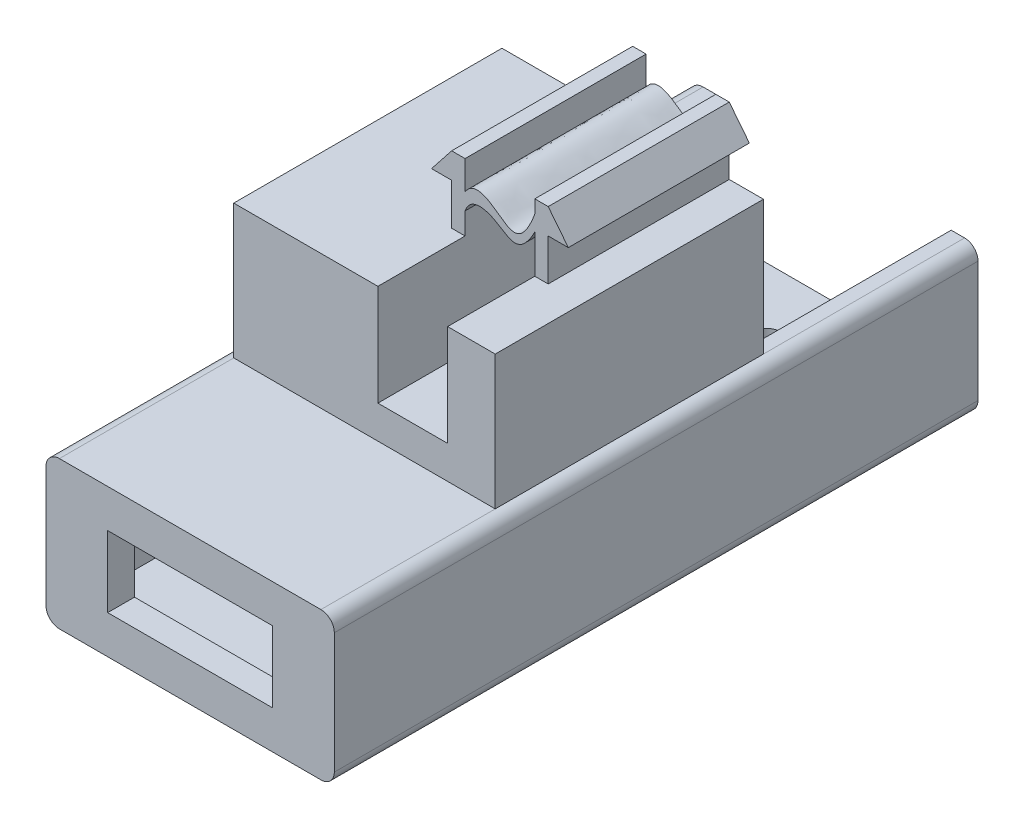
from build123d import *

# Parameters (mm, degrees)
ESBO_O1_W                = 17.5
ESBO_O1_H                = 7
RESSALTO_EXTRUS_O1_DEPTH = 36
RESSALTO_EXTRUS_O2_START = 2
ESBO_O1_3_W              = 17.5
ESBO_O1_3_H              = 7
ESBO_O1_3_W_2            = 12.3
ESBO_O1_3_H_2            = 5.3
RESSALTO_EXTRUS_O2_DEPTH = 2
RESSALTO_EXTRUS_O3_START = -36
ESBO_O1_4_W              = 17.5
ESBO_O1_4_H              = 7
RESSALTO_EXTRUS_O3_DEPTH = 10
ESBO_O2_W                = 17.5
ESBO_O2_H                = 33.092970434
CORTE_EXTRUS_O1_DEPTH    = 2
ESBO_O4_W                = 7.2
ESBO_O4_H                = 13.5
RESSALTO_EXTRUS_O4_DEPTH = 15
RESSALTO_EXTRUS_O5_START = -5
ESBO_O5_W                = 19.5
ESBO_O5_H                = 20
RESSALTO_EXTRUS_O5_DEPTH = 12
RESSALTO_EXTRUS_O6_START = -33
RESSALTO_EXTRUS_O6_DEPTH = 13.5
CORTE_EXTRUS_O2_START    = -33
CORTE_EXTRUS_O2_DEPTH    = 20
ESBO_O8_R                = 1.1
CORTE_EXTRUS_O3_DEPTH    = 12
RESSALTO_EXTRUS_O7_DEPTH = 0.3


# Read off the part's stored shape, not the designer's step: Corte-extrusão2
with BuildPart() as part:
    # Esboço1 → Ressalto-extrusão1 (new body)
    with BuildSketch(Plane.XY):
        with BuildLine():
            Line((-9.75, 5.5), (9.75, 5.5))
            ThreePointArc((9.75, 5.5), (10.457106781, 5.207106781), (10.75, 4.5))
            Line((10.75, 4.5), (10.75, -4.5))
            ThreePointArc((10.75, -4.5), (10.457106781, -5.207106781), (9.75, -5.5))
            Line((9.75, -5.5), (-9.75, -5.5))
            ThreePointArc((-9.75, -5.5), (-10.457106781, -5.207106781), (-10.75, -4.5))
            Line((-10.75, -4.5), (-10.75, 4.5))
            ThreePointArc((-10.75, 4.5), (-10.457106781, 5.207106781), (-9.75, 5.5))
        make_face()
        Rectangle(ESBO_O1_W, ESBO_O1_H, mode=Mode.SUBTRACT)
    extrude(amount=-RESSALTO_EXTRUS_O1_DEPTH)

    # Esboço1<3> → Ressalto-extrusão2 (add)
    # profile 1 of 2: a face of its own
    with BuildSketch(Plane.XY.offset(RESSALTO_EXTRUS_O2_START)):
        with BuildLine():
            Line((-9.75, 5.5), (9.75, 5.5))
            ThreePointArc((9.75, 5.5), (10.457106781, 5.207106781), (10.75, 4.5))
            Line((10.75, 4.5), (10.75, -4.5))
            ThreePointArc((10.75, -4.5), (10.457106781, -5.207106781), (9.75, -5.5))
            Line((9.75, -5.5), (-9.75, -5.5))
            ThreePointArc((-9.75, -5.5), (-10.457106781, -5.207106781), (-10.75, -4.5))
            Line((-10.75, -4.5), (-10.75, 4.5))
            ThreePointArc((-10.75, 4.5), (-10.457106781, 5.207106781), (-9.75, 5.5))
        make_face()
        Rectangle(ESBO_O1_3_W, ESBO_O1_3_H, mode=Mode.SUBTRACT)
    # profile 2 of 2: a face of its own
    with BuildSketch(Plane.XY.offset(RESSALTO_EXTRUS_O2_START)):
        Rectangle(ESBO_O1_3_W, ESBO_O1_3_H)
        Rectangle(ESBO_O1_3_W_2, ESBO_O1_3_H_2, mode=Mode.SUBTRACT)
    extrude(amount=-RESSALTO_EXTRUS_O2_DEPTH)

    # Esboço1<4> → Ressalto-extrusão3 (add)
    with BuildSketch(Plane.XY.offset(RESSALTO_EXTRUS_O3_START)):
        with BuildLine():
            Line((-9.75, 5.5), (9.75, 5.5))
            ThreePointArc((9.75, 5.5), (10.457106781, 5.207106781), (10.75, 4.5))
            Line((10.75, 4.5), (10.75, -4.5))
            ThreePointArc((10.75, -4.5), (10.457106781, -5.207106781), (9.75, -5.5))
            Line((9.75, -5.5), (-9.75, -5.5))
            ThreePointArc((-9.75, -5.5), (-10.457106781, -5.207106781), (-10.75, -4.5))
            Line((-10.75, -4.5), (-10.75, 4.5))
            ThreePointArc((-10.75, 4.5), (-10.457106781, 5.207106781), (-9.75, 5.5))
        make_face()
        Rectangle(ESBO_O1_4_W, ESBO_O1_4_H, mode=Mode.SUBTRACT)
    extrude(amount=-RESSALTO_EXTRUS_O3_DEPTH)

    # Esboço2 → Corte-extrusão1 (cut)
    with BuildSketch(Plane(origin=(0, 5.5, 0), x_dir=(1, 0, 0), z_dir=(0, 1, 0))):
        with Locations((0, 47.546485217)):
            Rectangle(ESBO_O2_W, ESBO_O2_H)
    extrude(amount=-CORTE_EXTRUS_O1_DEPTH, mode=Mode.SUBTRACT)

    # Esboço4 → Ressalto-extrusão4 (add)
    with BuildSketch(Plane(origin=(0, 5.5, 0), x_dir=(1, 0, 0), z_dir=(0, 1, 0))):
        with Locations((3.6, 24.25)):
            Rectangle(ESBO_O4_W, ESBO_O4_H)
    extrude(amount=RESSALTO_EXTRUS_O4_DEPTH)

    # Esboço5 → Ressalto-extrusão5 (add)
    with BuildSketch(Plane(origin=(0, 20.5, 0), x_dir=(1, 0, 0), z_dir=(0, 1, 0)).offset(RESSALTO_EXTRUS_O5_START)):
        with Locations((0, 21)):
            Rectangle(ESBO_O5_W, ESBO_O5_H)
    extrude(amount=-RESSALTO_EXTRUS_O5_DEPTH)

    # Esboço6 → Ressalto-extrusão6 (add)
    with BuildSketch(Plane.XY.offset(2).offset(RESSALTO_EXTRUS_O6_START)):
        Polygon((7.2, 18.6), (8.7, 18.6), (7.2, 20.5), align=None)
        Polygon((0, 20.5), (-1.5, 18.6), (0, 18.6), align=None)
    extrude(amount=RESSALTO_EXTRUS_O6_DEPTH)

    # Corte-extrusão2 outline → Corte-extrusão2 (cut)
    with BuildSketch(Plane.XY.offset(2).offset(CORTE_EXTRUS_O2_START)):
        with BuildLine():
            add(Edge.make_bspline(
                [(1, 17.117776301), (1.392807157, 18.242284914), (3.793782864, 17.798079271), (4.98009006, 16.063611632), (6.2, 18.349246613)],
                knots=[0, 0, 0, 0, 0.431650305, 1, 1, 1, 1], degree=3))
            Line((1, 17.117776301), (1, 7.955613614))
            Line((1, 7.955613614), (6.2, 7.955613614))
            Line((6.2, 7.955613614), (6.2, 18.349246613))
        make_face()
        with BuildLine():
            Line((1, 20.5), (1, 18.349246613))
            add(Edge.make_bspline(
                [(1, 18.349246613), (1.607043976, 19.318450945), (3.826530144, 18.190561083), (5.118160412, 16.666681538), (6.2, 19.514216644)],
                knots=[0, 0, 0, 0, 0.401373469, 1, 1, 1, 1], degree=3))
            Line((6.2, 19.514216644), (6.2, 20.5))
            Line((6.2, 20.5), (1, 20.5))
        make_face()
    extrude(amount=CORTE_EXTRUS_O2_DEPTH, mode=Mode.SUBTRACT)

    # Esboço8 → Corte-extrusão3 (cut)
    with BuildSketch(Plane(origin=(0, -3.5, 0), x_dir=(1, 0, 0), z_dir=(0, 1, 0))):
        with Locations(Location((0, 41, 0), (0, 0, 270))):
            Circle(ESBO_O8_R)
    extrude(amount=-CORTE_EXTRUS_O3_DEPTH, mode=Mode.SUBTRACT)

    # Esboço10 → Ressalto-extrusão7 (add)
    # profile 1 of 2: a face of its own
    with BuildSketch(Plane.XZ.offset(5.5)):
        with BuildLine():
            add(Edge.make_bspline(
                [(-0.318359524, -4.649786515), (-0.12793019, -4.650877011), (0.246048441, -4.653018606), (0.794689133, -4.690127467), (1.320581721, -4.739039837), (1.821657676, -4.818693553), (2.300262204, -4.912395404), (2.756253242, -5.02959155), (3.18803164, -5.170771406), (3.46371748, -5.283081098), (3.598943855, -5.338170009)],
                knots=[0, 0, 0, 0, 1.141009212, 2.240794809, 3.294380675, 4.305229195, 5.280013876, 6.216333343, 7.125095522, 8, 8, 8, 8], degree=3))
            add(Edge.make_bspline(
                [(3.598943855, -5.338170009), (3.79118381, -5.428219471), (4.173402664, -5.607259266), (4.713508633, -5.939764305), (5.222872323, -6.316639162), (5.698823441, -6.73478113), (6.134196809, -7.183514911), (6.506813723, -7.664957424), (6.82925825, -8.162004461), (6.991428682, -8.515517746), (7.071730538, -8.690566754)],
                knots=[0, 0, 0, 0, 1.031372299, 2.050613973, 3.077158538, 4.108712802, 5.127684358, 6.111366908, 7.06480644, 8, 8, 8, 8], degree=3))
            add(Edge.make_bspline(
                [(7.071730538, -8.690566754), (7.120468921, -8.809389364), (7.218981622, -9.049560157), (7.341930633, -9.422813839), (7.441821148, -9.810229821), (7.53111163, -10.209005948), (7.592680355, -10.623014004), (7.644303615, -11.04890863), (7.671360263, -11.489020603), (7.674945253, -11.786717922), (7.676767151, -11.938008168)],
                knots=[0, 0, 0, 0, 0.92659354, 1.872881803, 2.832850937, 3.813025581, 4.820167273, 5.851730198, 6.908245912, 8, 8, 8, 8], degree=3))
            add(Edge.make_bspline(
                [(7.676767151, -11.938008168), (7.669976662, -12.208905077), (7.656687581, -12.739054053), (7.560701949, -13.513452664), (7.398621846, -14.246269512), (7.164354407, -14.935021059), (6.871520627, -15.585656135), (6.508273094, -16.193080816), (6.078635852, -16.758339223), (5.588150779, -17.279791373), (5.039438057, -17.750630074), (4.4318831, -18.155010942), (3.778557115, -18.503556481), (3.071006482, -18.78464113), (2.313225925, -19.003878553), (1.503521424, -19.154267563), (0.645195065, -19.254187743), (0.05545634, -19.264269818), (-0.24736033, -19.269446721)],
                knots=[0, 0, 0, 0, 1.064687426, 2.083607927, 3.061933343, 4.009715682, 4.938290439, 5.861555806, 6.785379163, 7.723907601, 8.670645075, 9.620815051, 10.587025556, 11.576201955, 12.607926824, 13.682791464, 14.810169074, 16, 16, 16, 16], degree=3))
            add(Edge.make_bspline(
                [(-0.24736033, -19.269446721), (-0.548086723, -19.263918039), (-1.133544825, -19.253154726), (-1.986081316, -19.158160766), (-2.788767815, -19.007696263), (-3.539777018, -18.785181607), (-4.24481722, -18.510870632), (-4.895570638, -18.164074501), (-5.500378713, -17.763216269), (-6.045659537, -17.294120416), (-6.536753605, -16.778134971), (-6.961493857, -16.214126635), (-7.326827182, -15.613061753), (-7.62029786, -14.965663697), (-7.848642587, -14.277378868), (-8.012276099, -13.548546803), (-8.108284401, -12.778159291), (-8.121502915, -12.251089443), (-8.12827091, -11.981225069)],
                knots=[0, 0, 0, 0, 1.188503542, 2.313794348, 3.386815875, 4.412724616, 5.406050757, 6.372287373, 7.322246111, 8.268662201, 9.209598637, 10.133005659, 11.054574072, 11.984756797, 12.936664457, 13.916615443, 14.933288873, 16, 16, 16, 16], degree=3))
            add(Edge.make_bspline(
                [(-8.12827091, -11.981225069), (-8.121426486, -11.708286804), (-8.108029982, -11.174068208), (-8.012887708, -10.394325518), (-7.848642713, -9.657371462), (-7.62056875, -8.964275132), (-7.328947854, -8.312250075), (-6.970008484, -7.705067339), (-6.542488593, -7.1423328), (-6.055256333, -6.62501445), (-5.512789328, -6.156062573), (-4.911695972, -5.755944821), (-4.267346355, -5.409083549), (-3.569985219, -5.133343557), (-2.82678612, -4.91205054), (-2.033473022, -4.76121942), (-1.192229223, -4.666041476), (-0.614973631, -4.655303872), (-0.318359524, -4.649786515)],
                knots=[0, 0, 0, 0, 1.080868081, 2.11556935, 3.105256676, 4.066632898, 5.000538419, 5.928691231, 6.853779256, 7.79363201, 8.738674366, 9.686979733, 10.647777075, 11.631556772, 12.651514868, 13.714488213, 14.825624133, 16, 16, 16, 16], degree=3))
        make_face()
        with BuildLine():
            add(Edge.make_bspline(
                [(-0.216491115, -7.613231151), (-0.429651959, -7.616189427), (-0.84243388, -7.621918071), (-1.441559658, -7.683009893), (-2.001721274, -7.775574148), (-2.521998116, -7.91220869), (-3.004172685, -8.083299354), (-3.444749643, -8.29878683), (-3.849739358, -8.54672345), (-4.206842824, -8.840221686), (-4.526052531, -9.157222984), (-4.800868823, -9.499369911), (-5.040397809, -9.858237991), (-5.226890094, -10.244153971), (-5.375920836, -10.647299276), (-5.486234351, -11.070749559), (-5.546848882, -11.516415341), (-5.555537592, -11.820532712), (-5.559952225, -11.975051226)],
                knots=[0, 0, 0, 0, 1.313760844, 2.544072881, 3.709057706, 4.810798106, 5.856328071, 6.8578978, 7.829608234, 8.776800457, 9.700893773, 10.598542645, 11.478326183, 12.355016441, 13.234159304, 14.125057487, 15.047363429, 16, 16, 16, 16], degree=3))
            add(Edge.make_bspline(
                [(-5.559952225, -11.975051226), (-5.555626084, -12.129589921), (-5.547111541, -12.433747015), (-5.485271824, -12.878874221), (-5.379638311, -13.303130813), (-5.231554886, -13.704794071), (-5.041020964, -14.085695441), (-4.808782167, -14.445500461), (-4.531518099, -14.782145399), (-4.217149655, -15.0989679), (-3.857515474, -15.384327145), (-3.453408382, -15.630665859), (-3.009263386, -15.842858972), (-2.52124366, -16.009007859), (-1.994937004, -16.148311591), (-1.423667945, -16.235374928), (-0.812608421, -16.297469204), (-0.39056349, -16.303102031), (-0.173274214, -16.306002085)],
                knots=[0, 0, 0, 0, 0.949185128, 1.868149516, 2.754265681, 3.630223372, 4.492411659, 5.365559627, 6.255051142, 7.166857153, 8.10270998, 9.067572068, 10.068471475, 11.120005306, 12.229988237, 13.408413857, 14.665725295, 16, 16, 16, 16], degree=3))
            add(Edge.make_bspline(
                [(-0.173274214, -16.306002085), (0.041905138, -16.302679594), (0.458620399, -16.296245274), (1.062127351, -16.240278251), (1.623535554, -16.14845759), (2.14298021, -16.021328537), (2.619176631, -15.851741064), (3.057185756, -15.655054088), (3.449681878, -15.410887428), (3.799600354, -15.131914923), (4.109155361, -14.82315549), (4.375439671, -14.487368695), (4.604113279, -14.129364681), (4.789097268, -13.745886032), (4.932302825, -13.336697367), (5.032546934, -12.903991575), (5.096184495, -12.447165477), (5.104299837, -12.134757009), (5.108448466, -11.975051226)],
                knots=[0, 0, 0, 0, 1.332102096, 2.579742291, 3.748638211, 4.851919079, 5.885623862, 6.874802917, 7.818925756, 8.739297243, 9.640302518, 10.519879355, 11.387702267, 12.265338757, 13.149908458, 14.066302139, 15.011477716, 16, 16, 16, 16], degree=3))
            add(Edge.make_bspline(
                [(5.108448466, -11.975051226), (5.10430966, -11.815342659), (5.096213535, -11.502928747), (5.032438084, -11.046141715), (4.932396642, -10.612013293), (4.786600773, -10.201724245), (4.597046927, -9.816993236), (4.366242493, -9.456496244), (4.096797722, -9.11763946), (3.784071459, -8.806048036), (3.430953411, -8.522463499), (3.03283588, -8.279015324), (2.594045202, -8.071424218), (2.113288617, -7.90110721), (1.589241849, -7.774849786), (1.025427317, -7.677810403), (0.418432336, -7.623316694), (-0.000301229, -7.616665254), (-0.216491115, -7.613231151)],
                knots=[0, 0, 0, 0, 0.981979984, 1.920900141, 2.831228887, 3.718021039, 4.592624278, 5.463440991, 6.346090553, 7.250083161, 8.173257457, 9.125226447, 10.113224917, 11.154132427, 12.2562525, 13.424702564, 14.670387795, 16, 16, 16, 16], degree=3))
        make_face(mode=Mode.SUBTRACT)
    # profile 2 of 2: a face of its own
    with BuildSketch(Plane.XZ.offset(5.5)):
        with BuildLine():
            Line((-4.967263298, -31.123225267), (-7.930707934, -31.123225267))
            Line((-7.930707934, -31.123225267), (-7.930707934, -21.047513503))
            add(Edge.make_bspline(
                [(-7.930707934, -21.047513503), (-7.677461185, -21.08169368), (-7.171109687, -21.150034869), (-6.430688049, -21.36002255), (-5.709822746, -21.645486972), (-5.123768375, -21.952229314), (-4.647213352, -22.250502688), (-4.264038121, -22.531143682), (-3.848227601, -22.855209585), (-3.409500986, -23.233532662), (-2.939338814, -23.656674254), (-2.44188602, -24.129897218), (-1.918943103, -24.654694026), (-1.563864395, -25.02393212), (-1.380260519, -25.214857523)],
                knots=[0, 0, 0, 0, 1.156381417, 2.312114436, 3.475445649, 4.663832578, 5.302694182, 6.020660876, 6.814180865, 7.69035705, 8.644181007, 9.679458435, 10.800095821, 12, 12, 12, 12], degree=3))
            add(Edge.make_bspline(
                [(-1.380260519, -25.214857523), (-1.233220685, -25.36724459), (-0.953300147, -25.657344683), (-0.552036681, -26.070000785), (-0.185140792, -26.43378533), (0.145055063, -26.75080218), (0.434830178, -27.025270939), (0.690893828, -27.249813118), (0.908449981, -27.431431084), (1.046568733, -27.529701329), (1.107798207, -27.573265546)],
                knots=[0, 0, 0, 0, 1.480739016, 2.818890974, 4.024686436, 5.093297083, 6.019761393, 6.815071481, 7.474708909, 8, 8, 8, 8], degree=3))
            add(Edge.make_bspline(
                [(1.107798207, -27.573265546), (1.2558394, -27.662934162), (1.541057086, -27.835690639), (1.992674051, -28.018437884), (2.440321138, -28.137711643), (2.741101168, -28.152507576), (2.88895191, -28.159780631)],
                knots=[0, 0, 0, 0, 1.091434863, 2.102769638, 3.067401785, 4, 4, 4, 4], degree=3))
            add(Edge.make_bspline(
                [(2.88895191, -28.159780631), (3.042748941, -28.154333828), (3.333720928, -28.144028903), (3.743211787, -28.054759227), (4.097726741, -27.903309635), (4.393081198, -27.687367285), (4.626504492, -27.415397793), (4.7962506, -27.09553377), (4.892047149, -26.726653966), (4.904419293, -26.467675859), (4.910885491, -26.332323105)],
                knots=[0, 0, 0, 0, 1.192552326, 2.256215989, 3.232470907, 4.163657734, 5.069678789, 5.991331675, 6.950186205, 8, 8, 8, 8], degree=3))
            add(Edge.make_bspline(
                [(4.910885491, -26.332323105), (4.904795932, -26.197914197), (4.893032219, -25.938265206), (4.790266039, -25.569247653), (4.612366969, -25.246425401), (4.409633819, -25.016365095), (4.212490555, -24.860948446), (4.040693187, -24.755052963), (3.845478692, -24.663779324), (3.629044861, -24.582903264), (3.388912215, -24.519020321), (3.126909606, -24.467572965), (2.841627088, -24.42611384), (2.643164206, -24.412929106), (2.540129781, -24.406084091)],
                knots=[0, 0, 0, 0, 1.402788338, 2.709884207, 3.961032948, 5.225417836, 5.883680772, 6.578928686, 7.329201998, 8.132101139, 8.990263233, 9.922304639, 10.921339128, 12, 12, 12, 12], degree=3))
            Line((2.540129781, -24.406084091), (2.830300402, -21.442639455))
            add(Edge.make_bspline(
                [(2.830300402, -21.442639455), (3.030370267, -21.466465091), (3.418273769, -21.512659192), (3.975436945, -21.627937346), (4.489445125, -21.773932856), (4.959344403, -21.957605821), (5.388122882, -22.171364814), (5.769346474, -22.426113321), (6.107238057, -22.712950162), (6.4016178, -23.032123226), (6.6534222, -23.381603428), (6.878196267, -23.748320191), (7.062582454, -24.139440186), (7.214544376, -24.55065717), (7.335991129, -24.981785306), (7.416290075, -25.434818619), (7.472772662, -25.906961158), (7.477028027, -26.229247626), (7.479204175, -26.394061535)],
                knots=[0, 0, 0, 0, 1.270971563, 2.464210789, 3.586263665, 4.638946707, 5.643716971, 6.603612468, 7.52484387, 8.434700188, 9.336036235, 10.239171475, 11.145359471, 12.059630629, 13.003312604, 13.96741569, 14.960557767, 16, 16, 16, 16], degree=3))
            add(Edge.make_bspline(
                [(7.479204175, -26.394061535), (7.475760876, -26.57323578), (7.469054617, -26.92220012), (7.413664359, -27.431622215), (7.317107705, -27.910202164), (7.189125985, -28.362057564), (7.018541203, -28.782783024), (6.810934505, -29.17579161), (6.563014033, -29.537089837), (6.281670155, -29.867067219), (5.975487731, -30.163233983), (5.643731167, -30.416793045), (5.299398817, -30.639401565), (4.9308979, -30.814148796), (4.547472015, -30.956520761), (4.142355955, -31.048128307), (3.721550366, -31.115116124), (3.433561344, -31.120492325), (3.287164784, -31.123225267)],
                knots=[0, 0, 0, 0, 1.21054264, 2.357683783, 3.456743179, 4.506371233, 5.526380269, 6.518616322, 7.504105716, 8.480749833, 9.444588379, 10.376395364, 11.298423092, 12.209585683, 13.126776925, 14.056012185, 15.011791738, 16, 16, 16, 16], degree=3))
            add(Edge.make_bspline(
                [(3.287164784, -31.123225267), (3.119192924, -31.119448107), (2.785962531, -31.111954801), (2.293291226, -31.040445967), (1.812206624, -30.930655774), (1.340056045, -30.77027373), (0.870619413, -30.559585259), (0.392323704, -30.301661293), (-0.09442336, -29.989255143), (-0.413418499, -29.751545746), (-0.57766093, -29.629155263)],
                knots=[0, 0, 0, 0, 0.953498, 1.891593709, 2.82157134, 3.753035249, 4.718494268, 5.740911752, 6.836853288, 8, 8, 8, 8], degree=3))
            add(Edge.make_bspline(
                [(-0.57766093, -29.629155263), (-0.636735638, -29.582328478), (-0.763259969, -29.482036358), (-0.955848826, -29.310900042), (-1.171083079, -29.116666067), (-1.399889149, -28.890427927), (-1.652154321, -28.640494722), (-1.91836118, -28.36024393), (-2.203236592, -28.052506898), (-2.501005452, -27.729651209), (-2.789829168, -27.403561987), (-3.064990325, -27.105437314), (-3.312354957, -26.838340298), (-3.534766975, -26.604849871), (-3.727941629, -26.400865008), (-3.895890221, -26.23027696), (-4.036090222, -26.090337581), (-4.254571239, -25.897462843), (-4.550084232, -25.652067403), (-4.832449122, -25.47941717), (-4.967263298, -25.396985891)],
                knots=[0, 0, 0, 0, 0.665546509, 1.425446362, 2.274432636, 3.225431318, 4.2662943, 5.410247296, 6.638261485, 7.969509561, 9.288545809, 10.484715594, 11.551975365, 12.503234464, 13.332293902, 14.032657109, 14.617374704, 15.080693821, 16.606187002, 18, 18, 18, 18], degree=3))
            Line((-4.967263298, -25.396985891), (-4.967263298, -31.123225267))
        make_face()
    extrude(amount=RESSALTO_EXTRUS_O7_DEPTH)


solid = part.part
